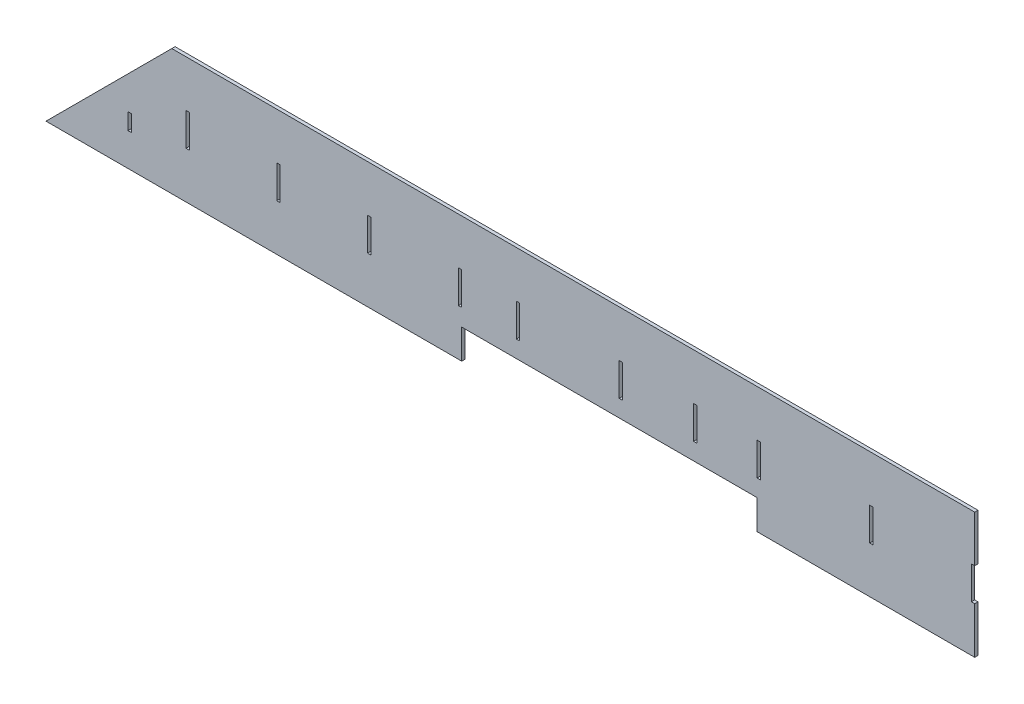
from build123d import *

# Parameters (mm, degrees)
SKETCH1_W           = 3
SKETCH1_H           = 30
SKETCH1_H_2         = 15
BOSS_EXTRUDE1_DEPTH = 3
SKETCH2_W           = 270
SKETCH2_H           = 27
CUT_EXTRUDE1_DEPTH  = 10


with BuildPart() as part:
    # Sketch1 → Boss-Extrude1 (new body)
    with BuildSketch(Plane.XY):
        Polygon((0, 0), (115, 115), (849, 115), (849, 72.5), (846, 72.5), (846, 42.5), (849, 42.5), (849, 0), align=None)
        with Locations((129.5, 57.5)):
            Rectangle(SKETCH1_W, SKETCH1_H, mode=Mode.SUBTRACT)
        with Locations((76.5, 37.5)):
            Rectangle(SKETCH1_W, SKETCH1_H_2, mode=Mode.SUBTRACT)
        with Locations((212.5, 57.5)):
            Rectangle(SKETCH1_W, SKETCH1_H, mode=Mode.SUBTRACT)
        with Locations((295.5, 57.5)):
            Rectangle(SKETCH1_W, SKETCH1_H, mode=Mode.SUBTRACT)
        with Locations((378.5, 57.5)):
            Rectangle(SKETCH1_W, SKETCH1_H, mode=Mode.SUBTRACT)
        with Locations((431.5, 57.5)):
            Rectangle(SKETCH1_W, SKETCH1_H, mode=Mode.SUBTRACT)
        with Locations((525.5, 57.5)):
            Rectangle(SKETCH1_W, SKETCH1_H, mode=Mode.SUBTRACT)
        with Locations((593.5, 57.5)):
            Rectangle(SKETCH1_W, SKETCH1_H, mode=Mode.SUBTRACT)
        with Locations((651.5, 57.5)):
            Rectangle(SKETCH1_W, SKETCH1_H, mode=Mode.SUBTRACT)
        with Locations((754.5, 57.5)):
            Rectangle(SKETCH1_W, SKETCH1_H, mode=Mode.SUBTRACT)
    extrude(amount=BOSS_EXTRUDE1_DEPTH)

    # Sketch2 → Cut-Extrude1 (cut)
    with BuildSketch(Plane.XY.offset(3)):
        with Locations((515, 13.5)):
            Rectangle(SKETCH2_W, SKETCH2_H)
    extrude(amount=-CUT_EXTRUDE1_DEPTH, mode=Mode.SUBTRACT)


solid = part.part
